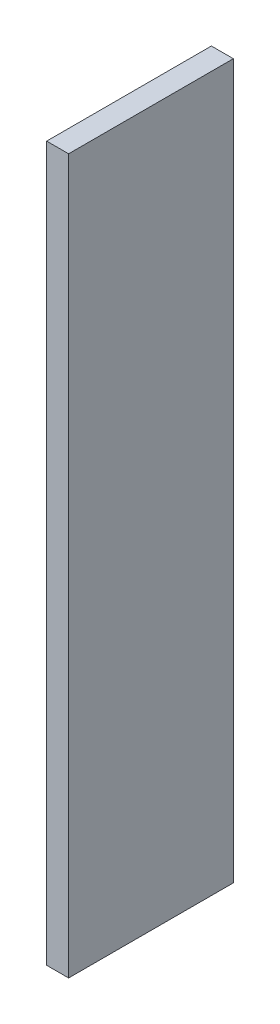
from build123d import *

# Parameters (mm, degrees)
SKETCH1_W           = 0.4
SKETCH1_H           = 13
BOSS_EXTRUDE1_DEPTH = 3


with BuildPart() as part:
    # Sketch1 → Boss-Extrude1 (new body)
    with BuildSketch(Plane.XY):
        with Locations((0.2, 6.5)):
            Rectangle(SKETCH1_W, SKETCH1_H)
    extrude(amount=BOSS_EXTRUDE1_DEPTH)


solid = part.part
